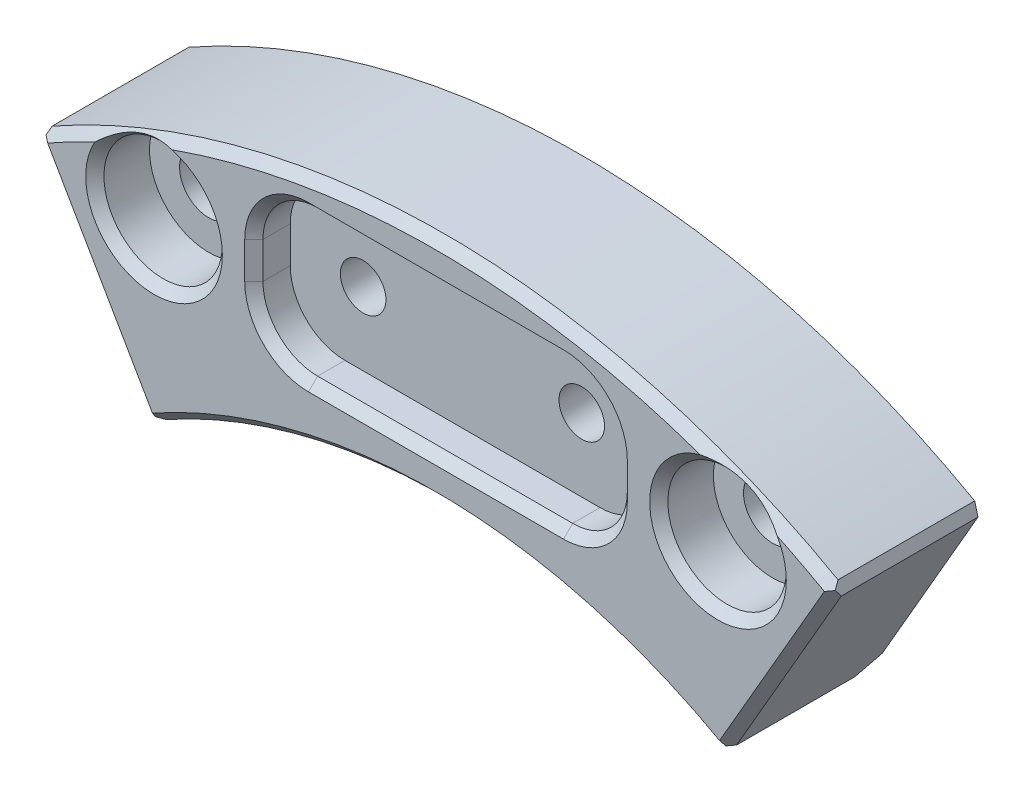
from build123d import *

# Parameters (mm, degrees)
EXTRUDE_1_DEPTH              = 8
CHAMFER_7_SIZE               = 1.5
HOLE_WIZARD_M3_1_D           = 3.2
HOLE_WIZARD_M3_1_CBORE_D     = 6.5
HOLE_WIZARD_M3_1_CBORE_DEPTH = 3
CUT_EXTRUDE_6_DEPTH          = 2
CHAMFER_8_SIZE               = 0.5
CHAMFER_9_SIZE               = 0.5
M3X0_5_1_D                   = 2.5
M3X0_5_1_DEPTH               = 8.5
M3X0_5_1_TIP                 = 0.751075774


with BuildPart() as part:
    # ｽｹｯﾁ3 → ﾎﾞｽ - 押し出し1 (new body)
    with BuildSketch(Plane.XY.offset(-16.5)):
        with BuildLine():
            Line((58.49999999, 38.105482977), (64.74999999, 27.280165429))
            ThreePointArc((64.74999999, 27.280165429), (80.49999999, 31.50036521), (96.24999999, 27.280165429))
            Line((96.24999999, 27.280165429), (102.49999999, 38.105482977))
            ThreePointArc((102.49999999, 38.105482977), (80.49999999, 44.00036521), (58.49999999, 38.105482977))
        make_face()
    extrude(amount=EXTRUDE_1_DEPTH)

    # 面取り7
    chamfer_7_edges = [part.edges().sort_by_distance(p)[0] for p in [
        (80.49999999, 31.50036521, -16.5),
    ]]
    chamfer(chamfer_7_edges, length=CHAMFER_7_SIZE)

    # M3 穴付きねじ用座ぐり穴1 (through all)
    with Locations(Plane.XY.offset(-8.5)):
        with Locations((65.0229264, 37.390950693), (95.977073581, 37.390950693)):
            CounterBoreHole(HOLE_WIZARD_M3_1_D / 2, HOLE_WIZARD_M3_1_CBORE_D / 2, HOLE_WIZARD_M3_1_CBORE_DEPTH)

    # ｽｹｯﾁ17 → ｶｯﾄ - 押し出し6 (cut)
    with BuildSketch(Plane.XY.offset(-8.5)):
        with BuildLine():
            Line((73.49999999, 41.75036521), (87.49999999, 41.75036521))
            ThreePointArc((87.49999999, 41.75036521), (89.621320334, 40.871685554), (90.49999999, 38.75036521))
            Line((90.49999999, 38.75036521), (90.49999999, 36.75036521))
            ThreePointArc((90.49999999, 36.75036521), (89.621320334, 34.629044867), (87.49999999, 33.75036521))
            Line((87.49999999, 33.75036521), (73.49999999, 33.75036521))
            ThreePointArc((73.49999999, 33.75036521), (71.378679647, 34.629044867), (70.49999999, 36.75036521))
            Line((70.49999999, 36.75036521), (70.49999999, 38.75036521))
            ThreePointArc((70.49999999, 38.75036521), (71.378679647, 40.871685554), (73.49999999, 41.75036521))
        make_face()
    extrude(amount=-CUT_EXTRUDE_6_DEPTH, mode=Mode.SUBTRACT)

    # 面取り8
    # the kernel refuses this chamfer: 0.5 mm, written as the material it takes off along each edge
    with BuildSketch(Plane(origin=(80.49999999, 0.00036521, -8.5), x_dir=(-0.5349312949950591, 0.844895561377209, 0), z_dir=(-0.844895561377209, -0.5349312949950591, 0))) as chamfer_8_piece_1:
        Polygon((31.5, CHAMFER_8_SIZE), (31.5 + CHAMFER_8_SIZE, 0), (31.5, 0), align=None)
    revolve(axis=Axis((80.49999999, 0.00036521, -8.5), (0, 0, -1)), revolution_arc=64.678504259, mode=Mode.SUBTRACT)
    with BuildSketch(Plane(origin=(95.607079243, 26.16659403, -8.5), x_dir=(-0.8660254037844379, 0.5000000000000012, 0), z_dir=(0.5000000000000012, 0.866025403784438, 0))) as chamfer_8_piece_2:
        Polygon((CHAMFER_8_SIZE, 0), (0, -CHAMFER_8_SIZE), (0, 0), align=None)
    extrude(amount=15.071682988, mode=Mode.SUBTRACT)
    with BuildSketch(Plane(origin=(80.49999999, 0.00036521, -8.5), x_dir=(0.5250957878127545, 0.8510431326444641, 0), z_dir=(0.8510431326444641, -0.5250957878127545, 0))) as chamfer_8_piece_3:
        Polygon((44 - CHAMFER_8_SIZE, 0), (44, -CHAMFER_8_SIZE), (44, 0), align=None)
    revolve(axis=Axis((80.49999999, 0.00036521, -8.5), (0, 0, 1)), revolution_arc=63.349383731, mode=Mode.SUBTRACT)
    with BuildSketch(Plane(origin=(95.977073581, 37.390950693, -8.5), x_dir=(1, 0, 0), z_dir=(0, -1, 0))) as chamfer_8_piece_4:
        Polygon((3.25 + CHAMFER_8_SIZE, 0), (3.25, -CHAMFER_8_SIZE), (3.25, 0), align=None)
    revolve(axis=Axis((95.977073581, 37.390950693, -8.5), (0, 0, 1)), mode=Mode.SUBTRACT)
    with BuildSketch(Plane(origin=(65.0229264, 37.390950693, -8.5), x_dir=(1, 0, 0), z_dir=(0, -1, 0))) as chamfer_8_piece_5:
        Polygon((3.25 + CHAMFER_8_SIZE, 0), (3.25, -CHAMFER_8_SIZE), (3.25, 0), align=None)
    revolve(axis=Axis((65.0229264, 37.390950693, -8.5), (0, 0, 1)), mode=Mode.SUBTRACT)
    with BuildSketch(Plane(origin=(57.857079243, 39.219054376, -8.5), x_dir=(0, 0, -1), z_dir=(0.5000000000000007, -0.8660254037844384, 0))) as chamfer_8_piece_6:
        Polygon((CHAMFER_8_SIZE, 0), (0, CHAMFER_8_SIZE), (0, 0), align=None)
    extrude(amount=15.071682988, mode=Mode.SUBTRACT)
    with BuildSketch(Plane(origin=(87.49999999, 38.75036521, -8.5), x_dir=(0, 1, 0), z_dir=(-1, 0, 0))) as chamfer_8_piece_7:
        Polygon((3 + CHAMFER_8_SIZE, 0), (3, CHAMFER_8_SIZE), (3, 0), align=None)
    revolve(axis=Axis((87.49999999, 38.75036521, -8.5), (0, 0, -1)), revolution_arc=90, mode=Mode.SUBTRACT)
    with BuildSketch(Plane(origin=(73.49999999, 41.75036521, -8.5), x_dir=(0, 1, 0), z_dir=(1, 0, 0)), Plane(origin=(87.49999999, 33.75036521, -8.5), x_dir=(0, -1, 0), z_dir=(-1, 0, 0))) as chamfer_8_piece_8:
        Polygon((CHAMFER_8_SIZE, 0), (0, -CHAMFER_8_SIZE), (0, 0), align=None)
    extrude(amount=14, mode=Mode.SUBTRACT)
    with BuildSketch(Plane(origin=(73.49999999, 38.75036521, -8.5), x_dir=(-1, 0, 0), z_dir=(0, -1, 0))) as chamfer_8_piece_9:
        Polygon((3 + CHAMFER_8_SIZE, 0), (3, CHAMFER_8_SIZE), (3, 0), align=None)
    revolve(axis=Axis((73.49999999, 38.75036521, -8.5), (0, 0, -1)), revolution_arc=90, mode=Mode.SUBTRACT)
    with BuildSketch(Plane(origin=(70.49999999, 36.75036521, -8.5), x_dir=(-1, 0, 0), z_dir=(0, 1, 0)), Plane(origin=(90.49999999, 38.75036521, -8.5), x_dir=(1, 0, 0), z_dir=(0, -1, 0))) as chamfer_8_piece_10:
        Polygon((CHAMFER_8_SIZE, 0), (0, -CHAMFER_8_SIZE), (0, 0), align=None)
    extrude(amount=2, mode=Mode.SUBTRACT)
    with BuildSketch(Plane(origin=(73.49999999, 36.75036521, -8.5), x_dir=(0, -1, 0), z_dir=(1, 0, 0))) as chamfer_8_piece_11:
        Polygon((3 + CHAMFER_8_SIZE, 0), (3, CHAMFER_8_SIZE), (3, 0), align=None)
    revolve(axis=Axis((73.49999999, 36.75036521, -8.5), (0, 0, -1)), revolution_arc=90, mode=Mode.SUBTRACT)
    with BuildSketch(Plane(origin=(87.49999999, 36.75036521, -8.5), x_dir=(1, 0, 0), z_dir=(0, 1, 0))) as chamfer_8_piece_12:
        Polygon((3 + CHAMFER_8_SIZE, 0), (3, CHAMFER_8_SIZE), (3, 0), align=None)
    revolve(axis=Axis((87.49999999, 36.75036521, -8.5), (0, 0, -1)), revolution_arc=90, mode=Mode.SUBTRACT)

    # 面取り9
    # the kernel refuses this chamfer: 0.5 mm, written as the material it takes off along each edge
    with BuildSketch(Plane(origin=(96.24999999, 27.280165429, -16.296233904), x_dir=(-0.8699980733677616, 0.4930551209919465, 0), z_dir=(0, 0, 1))) as chamfer_9_piece_1:
        with BuildLine():
            Line((0.504048916, 0), (-CHAMFER_9_SIZE * 0.00800077643885, -CHAMFER_9_SIZE * 0.999967993276))
            Line((-CHAMFER_9_SIZE * 0.00800077643885, -CHAMFER_9_SIZE * 0.999967993276), (0, 0))
            ThreePointArc((0, 0), (0.259153689, -0.001007405), (0.504048916, 0))
        make_face()
    extrude(amount=8.592467809, mode=Mode.SUBTRACT)
    with BuildSketch(Plane(origin=(64.74999999, 27.280165429, -16.296233904), x_dir=(-0.499999999999999, 0.8660254037844393, 0), z_dir=(0, 0, 1))) as chamfer_9_piece_2:
        with BuildLine():
            Line((CHAMFER_9_SIZE, 0), (-0.004032783, -0.504032783))
            ThreePointArc((-0.004032783, -0.504032783), (-0.001066058, -0.259153454), (0, 0))
            Line((0, 0), (CHAMFER_9_SIZE, 0))
        make_face()
    extrude(amount=8.592467809, mode=Mode.SUBTRACT)
    with BuildSketch(Plane(origin=(58.49999999, 38.105482977, -17.785841494), x_dir=(0.5000000000000021, -0.8660254037844375, 0), z_dir=(0, 0, 1))) as chamfer_9_piece_3:
        with BuildLine():
            Line((CHAMFER_9_SIZE, 0), (0.002809166, 0.497190834))
            ThreePointArc((0.002809166, 0.497190834), (0.000742578, 0.255629249), (0, 0))
            Line((0, 0), (CHAMFER_9_SIZE, 0))
        make_face()
    extrude(amount=10.071682988, mode=Mode.SUBTRACT)
    with BuildSketch(Plane(origin=(102.49999999, 38.105482977, -17.785841494), x_dir=(-0.8688365739050292, 0.4950989879256175, 0), z_dir=(0, 0, 1))) as chamfer_9_piece_4:
        with BuildLine():
            Line((0.49719877, 0), (CHAMFER_9_SIZE * 0.00564998602096, CHAMFER_9_SIZE * 0.999984038702))
            Line((CHAMFER_9_SIZE * 0.00564998602096, CHAMFER_9_SIZE * 0.999984038702), (0, 0))
            ThreePointArc((0, 0), (0.255629364, -0.000701736), (0.49719877, 0))
        make_face()
    extrude(amount=10.071682988, mode=Mode.SUBTRACT)

    # M3x0.5 ねじ穴1
    with Locations(Plane.XY.offset(-10.5)):
        with Locations((74.49999999, 37.75036521), (86.49999999, 37.75036521)):
            Hole(M3X0_5_1_D / 2, depth=M3X0_5_1_DEPTH)
            with Locations((0, 0, -(M3X0_5_1_DEPTH + M3X0_5_1_TIP / 2))):  # 118° drill point
                Cone(0, M3X0_5_1_D / 2, M3X0_5_1_TIP, mode=Mode.SUBTRACT)


solid = part.part
